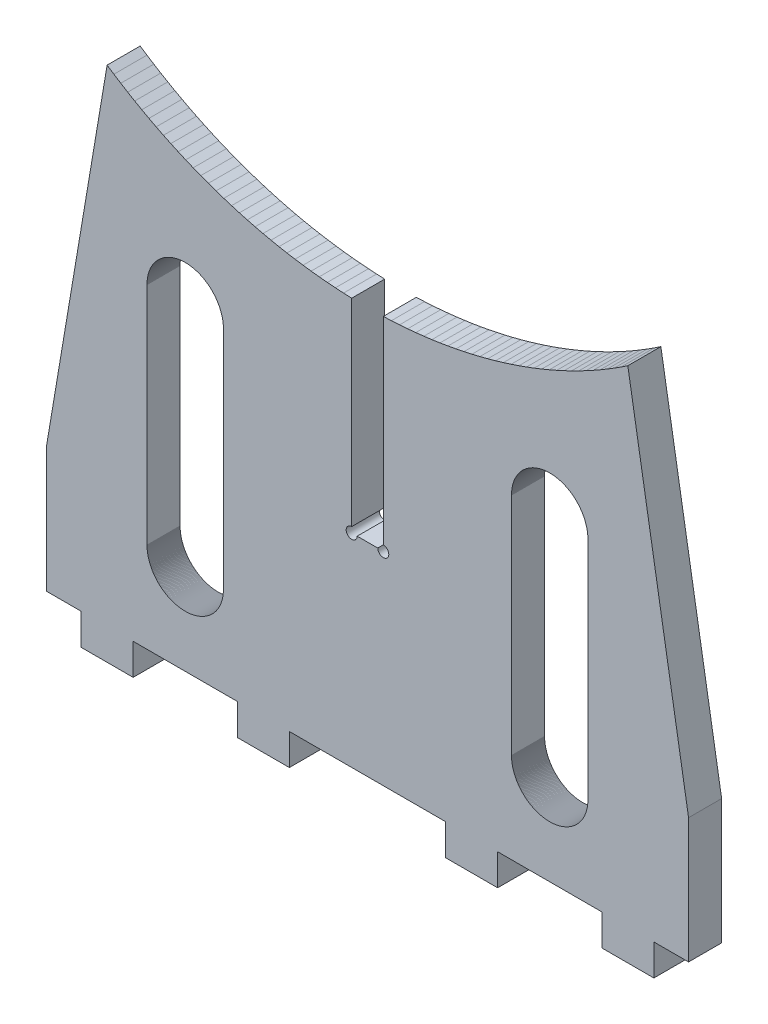
from build123d import *

# Parameters (mm, degrees)
BOSS_EXTRUDE1_DEPTH = 19.05


with BuildPart() as part:
    # Model → Boss-Extrude1 (new body)
    with BuildSketch(Plane.XY):
        with BuildLine():
            Line((9.1, 252.154792094), (9.1, 138.175))
            ThreePointArc((9.1, 138.175), (11.34506403, 137.24506403), (12.275, 135))
            ThreePointArc((12.275, 135), (9.1, 131.825), (5.925, 135))
            Line((5.925, 135), (-5.925, 135))
            ThreePointArc((-5.925, 135), (-11.34506403, 132.75493597), (-9.1, 138.175))
            Line((-9.1, 138.175), (-9.1, 252.154792094))
            Line((-9.1, 252.154792094), (-13.78728972, 252.355456717))
            Line((-13.78728972, 252.355456717), (-18.470340489, 252.638275926))
            Line((-18.470340489, 252.638275926), (-23.147712486, 253.003162769))
            Line((-23.147712486, 253.003162769), (-27.817967637, 253.45000506))
            Line((-27.817967637, 253.45000506), (-32.479670055, 253.978665415))
            Line((-32.479670055, 253.978665415), (-37.131386484, 254.588981296))
            Line((-37.131386484, 254.588981296), (-41.771686737, 255.280765059))
            Line((-41.771686737, 255.280765059), (-46.399144136, 256.053804012))
            Line((-46.399144136, 256.053804012), (-51.012335955, 256.907860483))
            Line((-51.012335955, 256.907860483), (-55.60984385, 257.842671888))
            Line((-55.60984385, 257.842671888), (-60.190254302, 258.857950817))
            Line((-60.190254302, 258.857950817), (-64.752159046, 259.953385118))
            Line((-64.752159046, 259.953385118), (-69.294155511, 261.128637996))
            Line((-69.294155511, 261.128637996), (-73.814847242, 262.383348115))
            Line((-73.814847242, 262.383348115), (-78.312844336, 263.717129711))
            Line((-78.312844336, 263.717129711), (-82.78676387, 265.129572707))
            Line((-82.78676387, 265.129572707), (-87.235230319, 266.620242844))
            Line((-87.235230319, 266.620242844), (-91.656875988, 268.188681808))
            Line((-91.656875988, 268.188681808), (-96.050341426, 269.834407379))
            Line((-96.050341426, 269.834407379), (-100.414275847, 271.556913571))
            Line((-100.414275847, 271.556913571), (-104.747337543, 273.355670795))
            Line((-104.747337543, 273.355670795), (-109.048194299, 275.230126015))
            Line((-109.048194299, 275.230126015), (-113.315523801, 277.179702924))
            Line((-113.315523801, 277.179702924), (-117.548014045, 279.203802119))
            Line((-117.548014045, 279.203802119), (-121.744363735, 281.301801281))
            Line((-121.744363735, 281.301801281), (-125.903282689, 283.473055375))
            Line((-125.903282689, 283.473055375), (-130.023492234, 285.716896839))
            Line((-130.023492234, 285.716896839), (-134.103725595, 288.032635798))
            Line((-134.103725595, 288.032635798), (-138.142728291, 290.419560269))
            Line((-138.142728291, 290.419560269), (-142.139258516, 292.876936384))
            Line((-142.139258516, 292.876936384), (-146.092087523, 295.404008613))
            Line((-146.092087523, 295.404008613), (-150, 298))
            Line((-150, 298), (-185, 90))
            Line((-185, 90), (-185, 18))
            Line((-185, 18), (-165, 18))
            Line((-165, 18), (-165, 0))
            Line((-165, 0), (-135, 0))
            Line((-135, 0), (-135, 18))
            Line((-135, 18), (-75, 18))
            Line((-75, 18), (-75, 0))
            Line((-75, 0), (-45, 0))
            Line((-45, 0), (-45, 18))
            Line((-45, 18), (0, 18))
            Line((0, 18), (45, 18))
            Line((45, 18), (45, 0))
            Line((45, 0), (75, 0))
            Line((75, 0), (75, 18))
            Line((75, 18), (135, 18))
            Line((135, 18), (135, 0))
            Line((135, 0), (165, 0))
            Line((165, 0), (165, 18))
            Line((165, 18), (185, 18))
            Line((185, 18), (185, 90))
            Line((185, 90), (150, 298))
            Line((150, 298), (146.092087523, 295.404008613))
            Line((146.092087523, 295.404008613), (142.139258516, 292.876936384))
            Line((142.139258516, 292.876936384), (138.142728291, 290.419560269))
            Line((138.142728291, 290.419560269), (134.103725595, 288.032635798))
            Line((134.103725595, 288.032635798), (130.023492234, 285.716896839))
            Line((130.023492234, 285.716896839), (125.903282689, 283.473055375))
            Line((125.903282689, 283.473055375), (121.744363735, 281.301801281))
            Line((121.744363735, 281.301801281), (117.548014045, 279.203802119))
            Line((117.548014045, 279.203802119), (113.315523801, 277.179702924))
            Line((113.315523801, 277.179702924), (109.048194299, 275.230126015))
            Line((109.048194299, 275.230126015), (104.747337543, 273.355670795))
            Line((104.747337543, 273.355670795), (100.414275847, 271.556913571))
            Line((100.414275847, 271.556913571), (96.050341426, 269.834407379))
            Line((96.050341426, 269.834407379), (91.656875988, 268.188681808))
            Line((91.656875988, 268.188681808), (87.235230319, 266.620242844))
            Line((87.235230319, 266.620242844), (82.78676387, 265.129572707))
            Line((82.78676387, 265.129572707), (78.312844336, 263.717129711))
            Line((78.312844336, 263.717129711), (73.814847242, 262.383348115))
            Line((73.814847242, 262.383348115), (69.294155511, 261.128637996))
            Line((69.294155511, 261.128637996), (64.752159046, 259.953385118))
            Line((64.752159046, 259.953385118), (60.190254302, 258.857950817))
            Line((60.190254302, 258.857950817), (55.60984385, 257.842671888))
            Line((55.60984385, 257.842671888), (51.012335955, 256.907860483))
            Line((51.012335955, 256.907860483), (46.399144136, 256.053804012))
            Line((46.399144136, 256.053804012), (41.771686737, 255.280765059))
            Line((41.771686737, 255.280765059), (37.131386484, 254.588981296))
            Line((37.131386484, 254.588981296), (32.479670055, 253.978665415))
            Line((32.479670055, 253.978665415), (27.817967637, 253.45000506))
            Line((27.817967637, 253.45000506), (23.147712486, 253.003162769))
            Line((23.147712486, 253.003162769), (18.470340489, 252.638275926))
            Line((18.470340489, 252.638275926), (13.78728972, 252.355456717))
            Line((13.78728972, 252.355456717), (9.1, 252.154792094))
        make_face()
        Polygon((-83.003350707, 200.383952942), (-83, 200), (-83, 70), (-83.003350707, 69.616047058), (-83.013401806, 69.232211073), (-83.030150235, 68.848608963), (-83.053590894, 68.465357578), (-83.083716642, 68.08257366), (-83.120518302, 67.700373808), (-83.163984664, 67.318874445), (-83.214102488, 66.938191779), (-83.270856507, 66.558441769), (-83.334229434, 66.179740091), (-83.404201964, 65.802202102), (-83.480752784, 65.425942802), (-83.563858575, 65.051076804), (-83.653494022, 64.677718297), (-83.749631822, 64.305981008), (-83.852242689, 63.935978172), (-83.961295369, 63.567822496), (-84.076756642, 63.201626124), (-84.198591337, 62.837500602), (-84.326762343, 62.475556847), (-84.461230617, 62.11590511), (-84.6019552, 61.758654945), (-84.748893224, 61.403915173), (-84.901999932, 61.051793852), (-85.061228685, 60.702398242), (-85.226530981, 60.355834771), (-85.397856468, 60.012209006), (-85.575152957, 59.671625619), (-85.758366443, 59.334188355), (-85.947441117, 59), (-86.142319385, 58.669162352), (-86.342941885, 58.341776187), (-86.549247505, 58.01794123), (-86.761173404, 57.697756124), (-86.978655026, 57.3813184), (-87.201626124, 57.06872445), (-87.430018779, 56.760069491), (-87.663763421, 56.455447543), (-87.902788848, 56.154951397), (-88.147022251, 55.858672587), (-88.396389235, 55.566701362), (-88.650813839, 55.27912666), (-88.910218564, 54.996036079), (-89.174524393, 54.71751585), (-89.443650814, 54.443650814), (-89.71751585, 54.174524393), (-89.996036079, 53.910218564), (-90.27912666, 53.650813839), (-90.566701362, 53.396389235), (-90.858672587, 53.147022251), (-91.154951397, 52.902788848), (-91.455447543, 52.663763421), (-91.760069491, 52.430018779), (-92.06872445, 52.201626124), (-92.3813184, 51.978655026), (-92.697756124, 51.761173404), (-93.01794123, 51.549247505), (-93.341776187, 51.342941885), (-93.669162352, 51.142319385), (-94, 50.947441117), (-94.334188355, 50.758366443), (-94.671625619, 50.575152957), (-95.012209006, 50.397856468), (-95.355834771, 50.226530981), (-95.702398242, 50.061228685), (-96.051793852, 49.901999932), (-96.403915173, 49.748893224), (-96.758654945, 49.6019552), (-97.11590511, 49.461230617), (-97.475556847, 49.326762343), (-97.837500602, 49.198591337), (-98.201626124, 49.076756642), (-98.567822496, 48.961295369), (-98.935978172, 48.852242689), (-99.305981008, 48.749631822), (-99.677718297, 48.653494022), (-100.051076804, 48.563858575), (-100.425942802, 48.480752784), (-100.802202102, 48.404201964), (-101.179740091, 48.334229434), (-101.558441769, 48.270856507), (-101.938191779, 48.214102488), (-102.318874445, 48.163984664), (-102.700373808, 48.120518302), (-103.08257366, 48.083716642), (-103.465357578, 48.053590894), (-103.848608963, 48.030150235), (-104.232211073, 48.013401806), (-104.616047058, 48.003350707), (-105, 48), (-105.383952942, 48.003350707), (-105.767788927, 48.013401806), (-106.151391037, 48.030150235), (-106.534642422, 48.053590894), (-106.91742634, 48.083716642), (-107.299626192, 48.120518302), (-107.681125555, 48.163984664), (-108.061808221, 48.214102488), (-108.441558231, 48.270856507), (-108.820259909, 48.334229434), (-109.197797898, 48.404201964), (-109.574057198, 48.480752784), (-109.948923196, 48.563858575), (-110.322281703, 48.653494022), (-110.694018992, 48.749631822), (-111.064021828, 48.852242689), (-111.432177504, 48.961295369), (-111.798373876, 49.076756642), (-112.162499398, 49.198591337), (-112.524443153, 49.326762343), (-112.88409489, 49.461230617), (-113.241345055, 49.6019552), (-113.596084827, 49.748893224), (-113.948206148, 49.901999932), (-114.297601758, 50.061228685), (-114.644165229, 50.226530981), (-114.987790994, 50.397856468), (-115.328374381, 50.575152957), (-115.665811645, 50.758366443), (-116, 50.947441117), (-116.330837648, 51.142319385), (-116.658223813, 51.342941885), (-116.98205877, 51.549247505), (-117.302243876, 51.761173404), (-117.6186816, 51.978655026), (-117.93127555, 52.201626124), (-118.239930509, 52.430018779), (-118.544552457, 52.663763421), (-118.845048603, 52.902788848), (-119.141327413, 53.147022251), (-119.433298638, 53.396389235), (-119.72087334, 53.650813839), (-120.003963921, 53.910218564), (-120.28248415, 54.174524393), (-120.556349186, 54.443650814), (-120.825475607, 54.71751585), (-121.089781436, 54.996036079), (-121.349186161, 55.27912666), (-121.603610765, 55.566701362), (-121.852977749, 55.858672587), (-122.097211152, 56.154951397), (-122.336236579, 56.455447543), (-122.569981221, 56.760069491), (-122.798373876, 57.06872445), (-123.021344974, 57.3813184), (-123.238826596, 57.697756124), (-123.450752495, 58.01794123), (-123.657058115, 58.341776187), (-123.857680615, 58.669162352), (-124.052558883, 59), (-124.241633557, 59.334188355), (-124.424847043, 59.671625619), (-124.602143532, 60.012209006), (-124.773469019, 60.355834771), (-124.938771315, 60.702398242), (-125.098000068, 61.051793852), (-125.251106776, 61.403915173), (-125.3980448, 61.758654945), (-125.538769383, 62.11590511), (-125.673237657, 62.475556847), (-125.801408663, 62.837500602), (-125.923243358, 63.201626124), (-126.038704631, 63.567822496), (-126.147757311, 63.935978172), (-126.250368178, 64.305981008), (-126.346505978, 64.677718297), (-126.436141425, 65.051076804), (-126.519247216, 65.425942802), (-126.595798036, 65.802202102), (-126.665770566, 66.179740091), (-126.729143493, 66.558441769), (-126.785897512, 66.938191779), (-126.836015336, 67.318874445), (-126.879481698, 67.700373808), (-126.916283358, 68.08257366), (-126.946409106, 68.465357578), (-126.969849765, 68.848608963), (-126.986598194, 69.232211073), (-126.996649293, 69.616047058), (-127, 70), (-127, 200), (-126.996649293, 200.383952942), (-126.986598194, 200.767788927), (-126.969849765, 201.151391037), (-126.946409106, 201.534642422), (-126.916283358, 201.91742634), (-126.879481698, 202.299626192), (-126.836015336, 202.681125555), (-126.785897512, 203.061808221), (-126.729143493, 203.441558231), (-126.665770566, 203.820259909), (-126.595798036, 204.197797898), (-126.519247216, 204.574057198), (-126.436141425, 204.948923196), (-126.346505978, 205.322281703), (-126.250368178, 205.694018992), (-126.147757311, 206.064021828), (-126.038704631, 206.432177504), (-125.923243358, 206.798373876), (-125.801408663, 207.162499398), (-125.673237657, 207.524443153), (-125.538769383, 207.88409489), (-125.3980448, 208.241345055), (-125.251106776, 208.596084827), (-125.098000068, 208.948206148), (-124.938771315, 209.297601758), (-124.773469019, 209.644165229), (-124.602143532, 209.987790994), (-124.424847043, 210.328374381), (-124.241633557, 210.665811645), (-124.052558883, 211), (-123.857680615, 211.330837648), (-123.657058115, 211.658223813), (-123.450752495, 211.98205877), (-123.238826596, 212.302243876), (-123.021344974, 212.6186816), (-122.798373876, 212.93127555), (-122.569981221, 213.239930509), (-122.336236579, 213.544552457), (-122.097211152, 213.845048603), (-121.852977749, 214.141327413), (-121.603610765, 214.433298638), (-121.349186161, 214.72087334), (-121.089781436, 215.003963921), (-120.825475607, 215.28248415), (-120.556349186, 215.556349186), (-120.28248415, 215.825475607), (-120.003963921, 216.089781436), (-119.72087334, 216.349186161), (-119.433298638, 216.603610765), (-119.141327413, 216.852977749), (-118.845048603, 217.097211152), (-118.544552457, 217.336236579), (-118.239930509, 217.569981221), (-117.93127555, 217.798373876), (-117.6186816, 218.021344974), (-117.302243876, 218.238826596), (-116.98205877, 218.450752495), (-116.658223813, 218.657058115), (-116.330837648, 218.857680615), (-116, 219.052558883), (-115.665811645, 219.241633557), (-115.328374381, 219.424847043), (-114.987790994, 219.602143532), (-114.644165229, 219.773469019), (-114.297601758, 219.938771315), (-113.948206148, 220.098000068), (-113.596084827, 220.251106776), (-113.241345055, 220.3980448), (-112.88409489, 220.538769383), (-112.524443153, 220.673237657), (-112.162499398, 220.801408663), (-111.798373876, 220.923243358), (-111.432177504, 221.038704631), (-111.064021828, 221.147757311), (-110.694018992, 221.250368178), (-110.322281703, 221.346505978), (-109.948923196, 221.436141425), (-109.574057198, 221.519247216), (-109.197797898, 221.595798036), (-108.820259909, 221.665770566), (-108.441558231, 221.729143493), (-108.061808221, 221.785897512), (-107.681125555, 221.836015336), (-107.299626192, 221.879481698), (-106.91742634, 221.916283358), (-106.534642422, 221.946409106), (-106.151391037, 221.969849765), (-105.767788927, 221.986598194), (-105.383952942, 221.996649293), (-105, 222), (-104.616047058, 221.996649293), (-104.232211073, 221.986598194), (-103.848608963, 221.969849765), (-103.465357578, 221.946409106), (-103.08257366, 221.916283358), (-102.700373808, 221.879481698), (-102.318874445, 221.836015336), (-101.938191779, 221.785897512), (-101.558441769, 221.729143493), (-101.179740091, 221.665770566), (-100.802202102, 221.595798036), (-100.425942802, 221.519247216), (-100.051076804, 221.436141425), (-99.677718297, 221.346505978), (-99.305981008, 221.250368178), (-98.935978172, 221.147757311), (-98.567822496, 221.038704631), (-98.201626124, 220.923243358), (-97.837500602, 220.801408663), (-97.475556847, 220.673237657), (-97.11590511, 220.538769383), (-96.758654945, 220.3980448), (-96.403915173, 220.251106776), (-96.051793852, 220.098000068), (-95.702398242, 219.938771315), (-95.355834771, 219.773469019), (-95.012209006, 219.602143532), (-94.671625619, 219.424847043), (-94.334188355, 219.241633557), (-94, 219.052558883), (-93.669162352, 218.857680615), (-93.341776187, 218.657058115), (-93.01794123, 218.450752495), (-92.697756124, 218.238826596), (-92.3813184, 218.021344974), (-92.06872445, 217.798373876), (-91.760069491, 217.569981221), (-91.455447543, 217.336236579), (-91.154951397, 217.097211152), (-90.858672587, 216.852977749), (-90.566701362, 216.603610765), (-90.27912666, 216.349186161), (-89.996036079, 216.089781436), (-89.71751585, 215.825475607), (-89.443650814, 215.556349186), (-89.174524393, 215.28248415), (-88.910218564, 215.003963921), (-88.650813839, 214.72087334), (-88.396389235, 214.433298638), (-88.147022251, 214.141327413), (-87.902788848, 213.845048603), (-87.663763421, 213.544552457), (-87.430018779, 213.239930509), (-87.201626124, 212.93127555), (-86.978655026, 212.6186816), (-86.761173404, 212.302243876), (-86.549247505, 211.98205877), (-86.342941885, 211.658223813), (-86.142319385, 211.330837648), (-85.947441117, 211), (-85.758366443, 210.665811645), (-85.575152957, 210.328374381), (-85.397856468, 209.987790994), (-85.226530981, 209.644165229), (-85.061228685, 209.297601758), (-84.901999932, 208.948206148), (-84.748893224, 208.596084827), (-84.6019552, 208.241345055), (-84.461230617, 207.88409489), (-84.326762343, 207.524443153), (-84.198591337, 207.162499398), (-84.076756642, 206.798373876), (-83.961295369, 206.432177504), (-83.852242689, 206.064021828), (-83.749631822, 205.694018992), (-83.653494022, 205.322281703), (-83.563858575, 204.948923196), (-83.480752784, 204.574057198), (-83.404201964, 204.197797898), (-83.334229434, 203.820259909), (-83.270856507, 203.441558231), (-83.214102488, 203.061808221), (-83.163984664, 202.681125555), (-83.120518302, 202.299626192), (-83.083716642, 201.91742634), (-83.053590894, 201.534642422), (-83.030150235, 201.151391037), (-83.013401806, 200.767788927), align=None, mode=Mode.SUBTRACT)
        Polygon((126.996649293, 200.383952942), (127, 200), (127, 70), (126.996649293, 69.616047058), (126.986598194, 69.232211073), (126.969849765, 68.848608963), (126.946409106, 68.465357578), (126.916283358, 68.08257366), (126.879481698, 67.700373808), (126.836015336, 67.318874445), (126.785897512, 66.938191779), (126.729143493, 66.558441769), (126.665770566, 66.179740091), (126.595798036, 65.802202102), (126.519247216, 65.425942802), (126.436141425, 65.051076804), (126.346505978, 64.677718297), (126.250368178, 64.305981008), (126.147757311, 63.935978172), (126.038704631, 63.567822496), (125.923243358, 63.201626124), (125.801408663, 62.837500602), (125.673237657, 62.475556847), (125.538769383, 62.11590511), (125.3980448, 61.758654945), (125.251106776, 61.403915173), (125.098000068, 61.051793852), (124.938771315, 60.702398242), (124.773469019, 60.355834771), (124.602143532, 60.012209006), (124.424847043, 59.671625619), (124.241633557, 59.334188355), (124.052558883, 59), (123.857680615, 58.669162352), (123.657058115, 58.341776187), (123.450752495, 58.01794123), (123.238826596, 57.697756124), (123.021344974, 57.3813184), (122.798373876, 57.06872445), (122.569981221, 56.760069491), (122.336236579, 56.455447543), (122.097211152, 56.154951397), (121.852977749, 55.858672587), (121.603610765, 55.566701362), (121.349186161, 55.27912666), (121.089781436, 54.996036079), (120.825475607, 54.71751585), (120.556349186, 54.443650814), (120.28248415, 54.174524393), (120.003963921, 53.910218564), (119.72087334, 53.650813839), (119.433298638, 53.396389235), (119.141327413, 53.147022251), (118.845048603, 52.902788848), (118.544552457, 52.663763421), (118.239930509, 52.430018779), (117.93127555, 52.201626124), (117.6186816, 51.978655026), (117.302243876, 51.761173404), (116.98205877, 51.549247505), (116.658223813, 51.342941885), (116.330837648, 51.142319385), (116, 50.947441117), (115.665811645, 50.758366443), (115.328374381, 50.575152957), (114.987790994, 50.397856468), (114.644165229, 50.226530981), (114.297601758, 50.061228685), (113.948206148, 49.901999932), (113.596084827, 49.748893224), (113.241345055, 49.6019552), (112.88409489, 49.461230617), (112.524443153, 49.326762343), (112.162499398, 49.198591337), (111.798373876, 49.076756642), (111.432177504, 48.961295369), (111.064021828, 48.852242689), (110.694018992, 48.749631822), (110.322281703, 48.653494022), (109.948923196, 48.563858575), (109.574057198, 48.480752784), (109.197797898, 48.404201964), (108.820259909, 48.334229434), (108.441558231, 48.270856507), (108.061808221, 48.214102488), (107.681125555, 48.163984664), (107.299626192, 48.120518302), (106.91742634, 48.083716642), (106.534642422, 48.053590894), (106.151391037, 48.030150235), (105.767788927, 48.013401806), (105.383952942, 48.003350707), (105, 48), (104.616047058, 48.003350707), (104.232211073, 48.013401806), (103.848608963, 48.030150235), (103.465357578, 48.053590894), (103.08257366, 48.083716642), (102.700373808, 48.120518302), (102.318874445, 48.163984664), (101.938191779, 48.214102488), (101.558441769, 48.270856507), (101.179740091, 48.334229434), (100.802202102, 48.404201964), (100.425942802, 48.480752784), (100.051076804, 48.563858575), (99.677718297, 48.653494022), (99.305981008, 48.749631822), (98.935978172, 48.852242689), (98.567822496, 48.961295369), (98.201626124, 49.076756642), (97.837500602, 49.198591337), (97.475556847, 49.326762343), (97.11590511, 49.461230617), (96.758654945, 49.6019552), (96.403915173, 49.748893224), (96.051793852, 49.901999932), (95.702398242, 50.061228685), (95.355834771, 50.226530981), (95.012209006, 50.397856468), (94.671625619, 50.575152957), (94.334188355, 50.758366443), (94, 50.947441117), (93.669162352, 51.142319385), (93.341776187, 51.342941885), (93.01794123, 51.549247505), (92.697756124, 51.761173404), (92.3813184, 51.978655026), (92.06872445, 52.201626124), (91.760069491, 52.430018779), (91.455447543, 52.663763421), (91.154951397, 52.902788848), (90.858672587, 53.147022251), (90.566701362, 53.396389235), (90.27912666, 53.650813839), (89.996036079, 53.910218564), (89.71751585, 54.174524393), (89.443650814, 54.443650814), (89.174524393, 54.71751585), (88.910218564, 54.996036079), (88.650813839, 55.27912666), (88.396389235, 55.566701362), (88.147022251, 55.858672587), (87.902788848, 56.154951397), (87.663763421, 56.455447543), (87.430018779, 56.760069491), (87.201626124, 57.06872445), (86.978655026, 57.3813184), (86.761173404, 57.697756124), (86.549247505, 58.01794123), (86.342941885, 58.341776187), (86.142319385, 58.669162352), (85.947441117, 59), (85.758366443, 59.334188355), (85.575152957, 59.671625619), (85.397856468, 60.012209006), (85.226530981, 60.355834771), (85.061228685, 60.702398242), (84.901999932, 61.051793852), (84.748893224, 61.403915173), (84.6019552, 61.758654945), (84.461230617, 62.11590511), (84.326762343, 62.475556847), (84.198591337, 62.837500602), (84.076756642, 63.201626124), (83.961295369, 63.567822496), (83.852242689, 63.935978172), (83.749631822, 64.305981008), (83.653494022, 64.677718297), (83.563858575, 65.051076804), (83.480752784, 65.425942802), (83.404201964, 65.802202102), (83.334229434, 66.179740091), (83.270856507, 66.558441769), (83.214102488, 66.938191779), (83.163984664, 67.318874445), (83.120518302, 67.700373808), (83.083716642, 68.08257366), (83.053590894, 68.465357578), (83.030150235, 68.848608963), (83.013401806, 69.232211073), (83.003350707, 69.616047058), (83, 70), (83, 200), (83.003350707, 200.383952942), (83.013401806, 200.767788927), (83.030150235, 201.151391037), (83.053590894, 201.534642422), (83.083716642, 201.91742634), (83.120518302, 202.299626192), (83.163984664, 202.681125555), (83.214102488, 203.061808221), (83.270856507, 203.441558231), (83.334229434, 203.820259909), (83.404201964, 204.197797898), (83.480752784, 204.574057198), (83.563858575, 204.948923196), (83.653494022, 205.322281703), (83.749631822, 205.694018992), (83.852242689, 206.064021828), (83.961295369, 206.432177504), (84.076756642, 206.798373876), (84.198591337, 207.162499398), (84.326762343, 207.524443153), (84.461230617, 207.88409489), (84.6019552, 208.241345055), (84.748893224, 208.596084827), (84.901999932, 208.948206148), (85.061228685, 209.297601758), (85.226530981, 209.644165229), (85.397856468, 209.987790994), (85.575152957, 210.328374381), (85.758366443, 210.665811645), (85.947441117, 211), (86.142319385, 211.330837648), (86.342941885, 211.658223813), (86.549247505, 211.98205877), (86.761173404, 212.302243876), (86.978655026, 212.6186816), (87.201626124, 212.93127555), (87.430018779, 213.239930509), (87.663763421, 213.544552457), (87.902788848, 213.845048603), (88.147022251, 214.141327413), (88.396389235, 214.433298638), (88.650813839, 214.72087334), (88.910218564, 215.003963921), (89.174524393, 215.28248415), (89.443650814, 215.556349186), (89.71751585, 215.825475607), (89.996036079, 216.089781436), (90.27912666, 216.349186161), (90.566701362, 216.603610765), (90.858672587, 216.852977749), (91.154951397, 217.097211152), (91.455447543, 217.336236579), (91.760069491, 217.569981221), (92.06872445, 217.798373876), (92.3813184, 218.021344974), (92.697756124, 218.238826596), (93.01794123, 218.450752495), (93.341776187, 218.657058115), (93.669162352, 218.857680615), (94, 219.052558883), (94.334188355, 219.241633557), (94.671625619, 219.424847043), (95.012209006, 219.602143532), (95.355834771, 219.773469019), (95.702398242, 219.938771315), (96.051793852, 220.098000068), (96.403915173, 220.251106776), (96.758654945, 220.3980448), (97.11590511, 220.538769383), (97.475556847, 220.673237657), (97.837500602, 220.801408663), (98.201626124, 220.923243358), (98.567822496, 221.038704631), (98.935978172, 221.147757311), (99.305981008, 221.250368178), (99.677718297, 221.346505978), (100.051076804, 221.436141425), (100.425942802, 221.519247216), (100.802202102, 221.595798036), (101.179740091, 221.665770566), (101.558441769, 221.729143493), (101.938191779, 221.785897512), (102.318874445, 221.836015336), (102.700373808, 221.879481698), (103.08257366, 221.916283358), (103.465357578, 221.946409106), (103.848608963, 221.969849765), (104.232211073, 221.986598194), (104.616047058, 221.996649293), (105, 222), (105.383952942, 221.996649293), (105.767788927, 221.986598194), (106.151391037, 221.969849765), (106.534642422, 221.946409106), (106.91742634, 221.916283358), (107.299626192, 221.879481698), (107.681125555, 221.836015336), (108.061808221, 221.785897512), (108.441558231, 221.729143493), (108.820259909, 221.665770566), (109.197797898, 221.595798036), (109.574057198, 221.519247216), (109.948923196, 221.436141425), (110.322281703, 221.346505978), (110.694018992, 221.250368178), (111.064021828, 221.147757311), (111.432177504, 221.038704631), (111.798373876, 220.923243358), (112.162499398, 220.801408663), (112.524443153, 220.673237657), (112.88409489, 220.538769383), (113.241345055, 220.3980448), (113.596084827, 220.251106776), (113.948206148, 220.098000068), (114.297601758, 219.938771315), (114.644165229, 219.773469019), (114.987790994, 219.602143532), (115.328374381, 219.424847043), (115.665811645, 219.241633557), (116, 219.052558883), (116.330837648, 218.857680615), (116.658223813, 218.657058115), (116.98205877, 218.450752495), (117.302243876, 218.238826596), (117.6186816, 218.021344974), (117.93127555, 217.798373876), (118.239930509, 217.569981221), (118.544552457, 217.336236579), (118.845048603, 217.097211152), (119.141327413, 216.852977749), (119.433298638, 216.603610765), (119.72087334, 216.349186161), (120.003963921, 216.089781436), (120.28248415, 215.825475607), (120.556349186, 215.556349186), (120.825475607, 215.28248415), (121.089781436, 215.003963921), (121.349186161, 214.72087334), (121.603610765, 214.433298638), (121.852977749, 214.141327413), (122.097211152, 213.845048603), (122.336236579, 213.544552457), (122.569981221, 213.239930509), (122.798373876, 212.93127555), (123.021344974, 212.6186816), (123.238826596, 212.302243876), (123.450752495, 211.98205877), (123.657058115, 211.658223813), (123.857680615, 211.330837648), (124.052558883, 211), (124.241633557, 210.665811645), (124.424847043, 210.328374381), (124.602143532, 209.987790994), (124.773469019, 209.644165229), (124.938771315, 209.297601758), (125.098000068, 208.948206148), (125.251106776, 208.596084827), (125.3980448, 208.241345055), (125.538769383, 207.88409489), (125.673237657, 207.524443153), (125.801408663, 207.162499398), (125.923243358, 206.798373876), (126.038704631, 206.432177504), (126.147757311, 206.064021828), (126.250368178, 205.694018992), (126.346505978, 205.322281703), (126.436141425, 204.948923196), (126.519247216, 204.574057198), (126.595798036, 204.197797898), (126.665770566, 203.820259909), (126.729143493, 203.441558231), (126.785897512, 203.061808221), (126.836015336, 202.681125555), (126.879481698, 202.299626192), (126.916283358, 201.91742634), (126.946409106, 201.534642422), (126.969849765, 201.151391037), (126.986598194, 200.767788927), align=None, mode=Mode.SUBTRACT)
    extrude(amount=BOSS_EXTRUDE1_DEPTH)


solid = part.part
